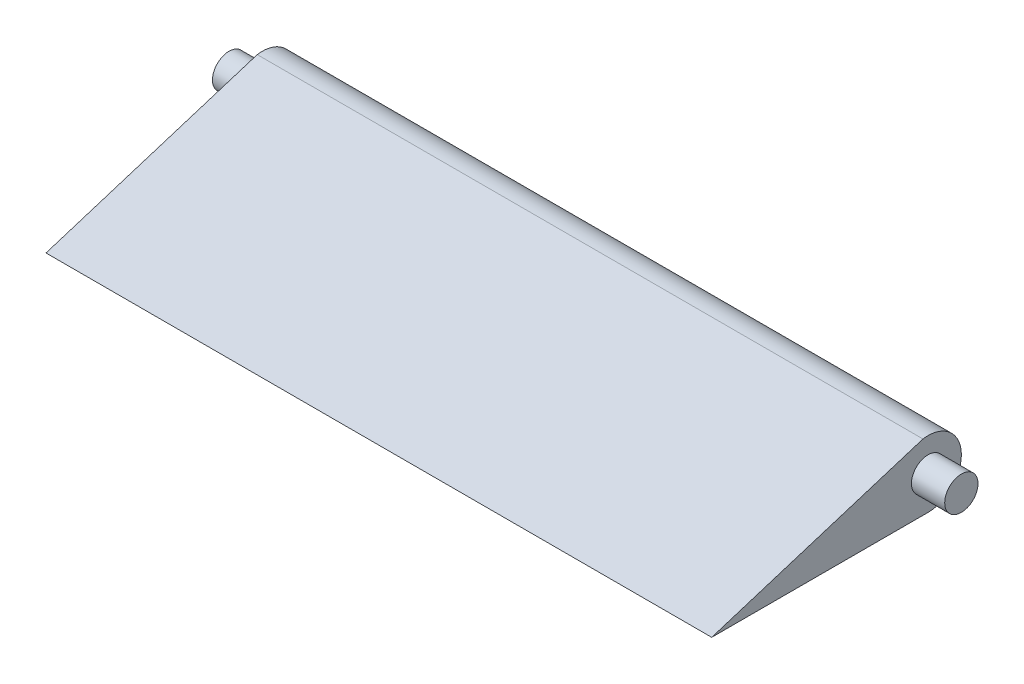
from build123d import *

# Parameters (mm, degrees)
SKETCH2_R           = 12.7
BOSS_EXTRUDE2_DEPTH = 508
SKETCH3_R           = 12.7
BOSS_EXTRUDE3_DEPTH = 279.4


with BuildPart() as part:
    # Sketch2 → Boss-Extrude2 (new body)
    with BuildSketch(Plane(origin=(0, 0, 0), x_dir=(0, 0, -1), z_dir=(1, 0, 0))):
        with BuildLine():
            Line((0, -25.4), (-165.1, -25.4))
            Line((-165.1, -25.4), (-3.907692308, 25.097608269))
            ThreePointArc((-3.907692308, 25.097608269), (25.32428923, 1.959687471), (0, -25.4))
        make_face()
        Circle(SKETCH2_R, mode=Mode.SUBTRACT)
    extrude(amount=BOSS_EXTRUDE2_DEPTH)

    # Sketch3 → Boss-Extrude3 (add, symmetric)
    with BuildSketch(Plane.ZY.offset(-254)):
        Circle(SKETCH3_R)
    extrude(amount=BOSS_EXTRUDE3_DEPTH, both=True)


solid = part.part
